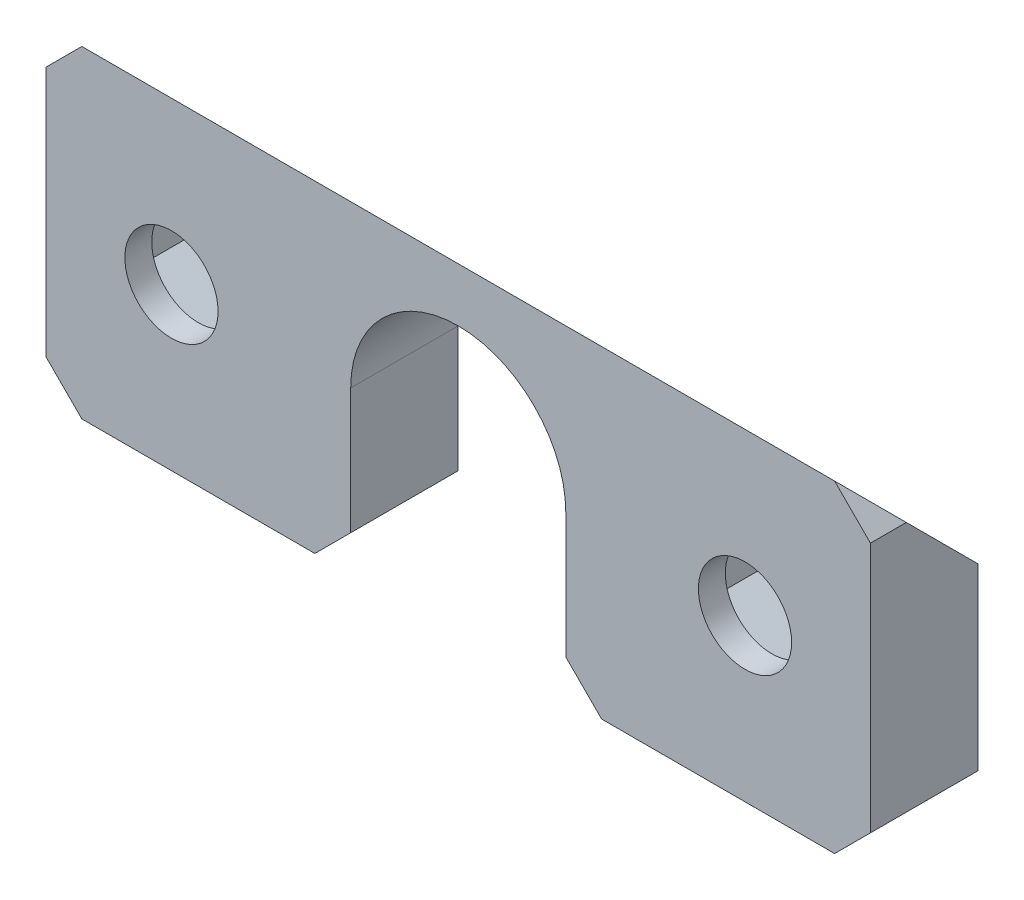
from build123d import *

# Parameters (mm, degrees)
BOSS_EXTRUDE1_DEPTH = 6
SKETCH2_R           = 2.6
BOSS_EXTRUDE2_DEPTH = 1.5
CHAMFER1_SIZE       = 2
CHAMFER2_SIZE       = 6


with BuildPart() as part:
    # Sketch1 → Boss-Extrude1 (new body)
    with BuildSketch(Plane(origin=(0, 0, 789.620141885), x_dir=(-1, 0, 0), z_dir=(0, 0, -1))):
        with BuildLine():
            Line((8.210843614, -513.298939869), (8.210843614, -527.298939869))
            Line((8.210843614, -527.298939869), (10.210843614, -529.298939869))
            Line((10.210843614, -529.298939869), (25.210843614, -529.298939869))
            Line((25.210843614, -529.298939869), (25.210843614, -520.298939869))
            ThreePointArc((25.210843614, -520.298939869), (31.210843614, -514.298939869), (37.210843614, -520.298939869))
            Line((37.210843614, -520.298939869), (37.210843614, -529.298939869))
            Line((37.210843614, -529.298939869), (52.210843614, -529.298939869))
            Line((52.210843614, -529.298939869), (54.210843614, -527.298939869))
            Line((54.210843614, -527.298939869), (54.210843614, -513.298939869))
            Line((54.210843614, -513.298939869), (52.210843614, -511.298939869))
            Line((52.210843614, -511.298939869), (10.210843614, -511.298939869))
            Line((10.210843614, -511.298939869), (8.210843614, -513.298939869))
        make_face()
        Polygon((10.960843614, -517.845201225), (10.960843614, -522.752678513), (15.210843614, -525.206417157), (19.460843614, -522.752678513), (19.460843614, -517.845201225), (15.210843614, -515.391462581), align=None, mode=Mode.SUBTRACT)
        Polygon((47.210843614, -515.391462581), (42.960843614, -517.845201225), (42.960843614, -522.752678513), (47.210843614, -525.206417157), (51.460843614, -522.752678513), (51.460843614, -517.845201225), align=None, mode=Mode.SUBTRACT)
    extrude(amount=BOSS_EXTRUDE1_DEPTH)

    # Sketch2 → Boss-Extrude2 (add)
    # profile 1 of 2: a face of its own
    with BuildSketch(Plane.XY.offset(789.620141885)):
        Polygon((-10.960843614, -517.845201225), (-15.210843614, -515.391462581), (-19.460843614, -517.845201225), (-19.460843614, -522.752678513), (-15.210843614, -525.206417157), (-10.960843614, -522.752678513), align=None)
        with Locations((-15.210843614, -520.298939869)):
            Circle(SKETCH2_R, mode=Mode.SUBTRACT)
    # profile 2 of 2: a face of its own
    with BuildSketch(Plane.XY.offset(789.620141885)):
        Polygon((-47.210843614, -515.391462581), (-51.460843614, -517.845201225), (-51.460843614, -522.752678513), (-47.210843614, -525.206417157), (-42.960843614, -522.752678513), (-42.960843614, -517.845201225), align=None)
        with Locations((-47.210843614, -520.298939869)):
            Circle(SKETCH2_R, mode=Mode.SUBTRACT)
    extrude(amount=-BOSS_EXTRUDE2_DEPTH)

    # Chamfer1
    chamfer1_edges = [part.edges().sort_by_distance(p)[0] for p in [
        (-25.210843614, -529.298939869, 786.620141885),
        (-37.210843614, -529.298939869, 786.620141885),
    ]]
    chamfer(chamfer1_edges, length=CHAMFER1_SIZE)

    # Chamfer2
    # the kernel refuses this chamfer: 6 mm, written as the material it takes off along each edge
    with BuildSketch(Plane(origin=(-67.640941541, -511.298939869, 783.620141885), x_dir=(0, 0.027495876610582292, 0.9996219169112969), z_dir=(1, 0, 0))) as chamfer2_piece_1:
        Polygon((CHAMFER2_SIZE * 0.999621916911, CHAMFER2_SIZE * 0.0274958766106), (-CHAMFER2_SIZE * 0.0274958766106, CHAMFER2_SIZE * 0.999621916911), (0, 0), align=None)
    extrude(amount=72.860195856, mode=Mode.SUBTRACT)


solid = part.part
